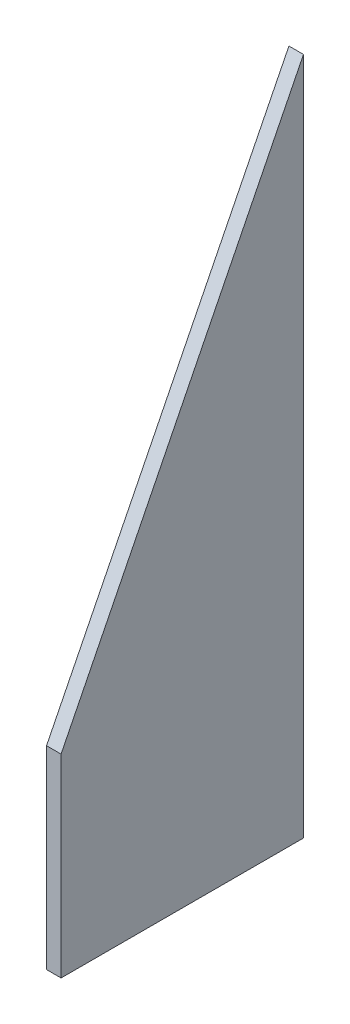
from build123d import *

# Parameters (mm, degrees)
BOSS_EXTRUDE1_DEPTH = 1.5


with BuildPart() as part:
    # Sketch1 → Boss-Extrude1 (new, symmetric)
    with BuildSketch(Plane(origin=(0, 0, 0), x_dir=(0, 0, -1), z_dir=(1, 0, 0))):
        Polygon((-33.9725, 0), (-83.9725, 0), (-83.9725, 40), (-33.9725, 140), align=None)
    extrude(amount=BOSS_EXTRUDE1_DEPTH, both=True)


solid = part.part
